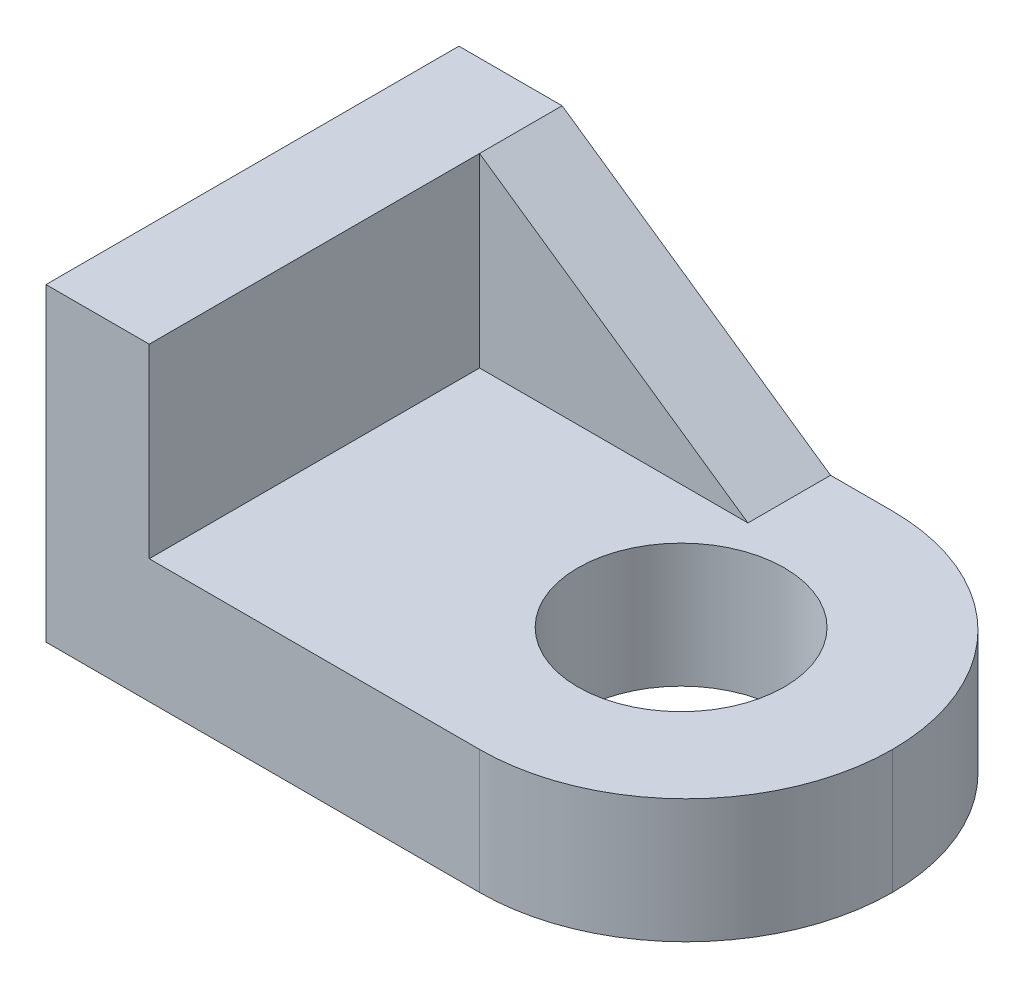
from build123d import *

# Parameters (mm, degrees)
EXTRUDE_1_DEPTH     = 20
FILLET_1_R          = 20
SKETCH_2_R          = 10
CUT_EXTRUDE_1_DEPTH = 68.586980995
EXTRUDE_2_DEPTH     = 8


with BuildPart() as part:
    # 草圖1 → 填料-伸長1 (new, symmetric)
    with BuildSketch(Plane.XY):
        Polygon((0, 0), (0, 30), (10, 30), (10, 12), (62, 12), (62, 0), align=None)
    extrude(amount=EXTRUDE_1_DEPTH, both=True)

    # 圓角1
    fillet_1_edges = [part.edges().sort_by_distance(p)[0] for p in [
        (62, 6, -20),
        (62, 6, 20),
    ]]
    fillet(fillet_1_edges, radius=FILLET_1_R - 0.0001)  # a hair under: the kernel refuses the full size

    # 草圖2 → 除料-伸長1 (cut, through all)
    with BuildSketch(Plane(origin=(0, 12, 0), x_dir=(1, 0, 0), z_dir=(0, 1, 0))):
        with Locations(Location((41.524228064, 0, 0), (0, 0, 270))):
            Circle(SKETCH_2_R)
    extrude(amount=-CUT_EXTRUDE_1_DEPTH, mode=Mode.SUBTRACT)

    # 草圖4 → 填料-伸長2 (add)
    with BuildSketch(Plane(origin=(0, 0, -20), x_dir=(-1, 0, 0), z_dir=(0, 0, -1))):
        Polygon((-10, 30), (-36, 12), (-10, 12), align=None)
    extrude(amount=-EXTRUDE_2_DEPTH)


solid = part.part
